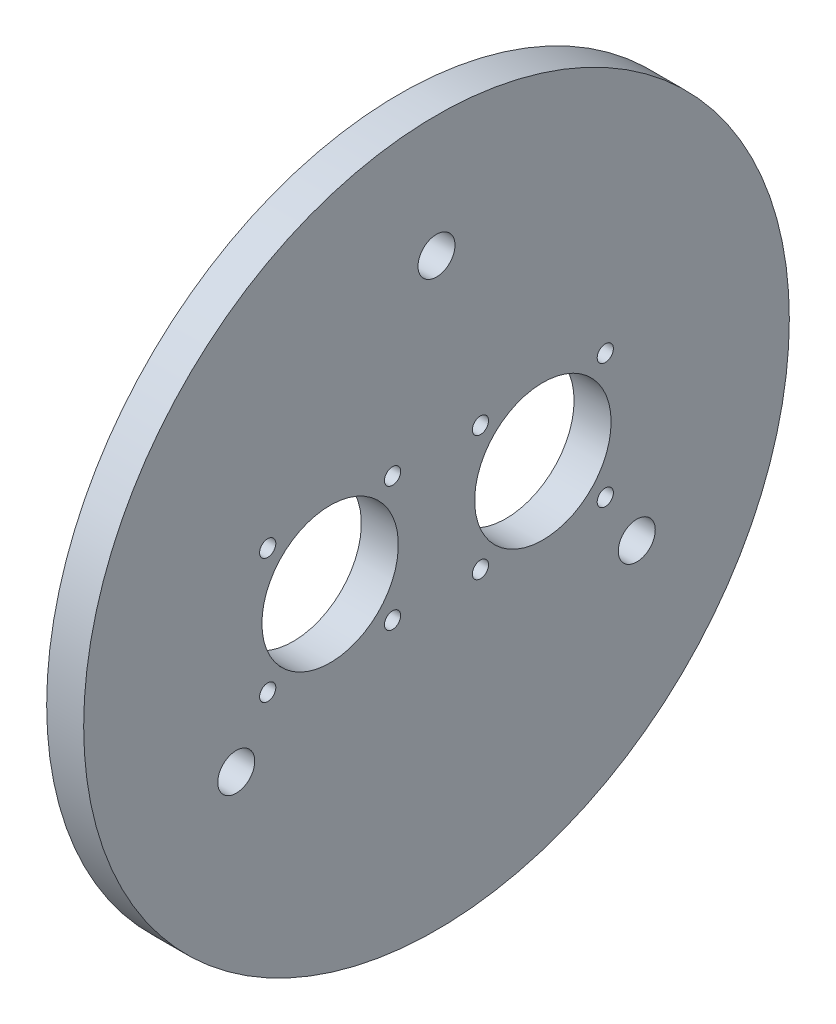
from build123d import *

# Parameters (mm, degrees)
SKETCH1_R           = 76.29
SKETCH1_R_2         = 4
SKETCH1_R_3         = 14.75
SKETCH1_R_4         = 1.75
BOSS_EXTRUDE1_DEPTH = 8


with BuildPart() as part:
    # Sketch1 → Boss-Extrude1 (new body)
    with BuildSketch(Plane(origin=(0, 0, 0), x_dir=(0, 0, -1), z_dir=(1, 0, 0))):
        Circle(SKETCH1_R)
        with Locations((0, 50)):
            Circle(SKETCH1_R_2, mode=Mode.SUBTRACT)
        with Locations((43.301270189, -25)):
            Circle(SKETCH1_R_2, mode=Mode.SUBTRACT)
        with Locations((-43.301270189, -25)):
            Circle(SKETCH1_R_2, mode=Mode.SUBTRACT)
        with Locations((23, 0)):
            Circle(SKETCH1_R_3, mode=Mode.SUBTRACT)
        with Locations((-23, 0)):
            Circle(SKETCH1_R_3, mode=Mode.SUBTRACT)
        with Locations((36.496900686, 13.496900686)):
            Circle(SKETCH1_R_4, mode=Mode.SUBTRACT)
        with Locations((36.496900686, -13.496900686)):
            Circle(SKETCH1_R_4, mode=Mode.SUBTRACT)
        with Locations((9.503099314, -13.496900686)):
            Circle(SKETCH1_R_4, mode=Mode.SUBTRACT)
        with Locations((9.503099314, 13.496900686)):
            Circle(SKETCH1_R_4, mode=Mode.SUBTRACT)
        with Locations((-36.496900686, -13.496900686)):
            Circle(SKETCH1_R_4, mode=Mode.SUBTRACT)
        with Locations((-9.503099314, -13.496900686)):
            Circle(SKETCH1_R_4, mode=Mode.SUBTRACT)
        with Locations((-9.503099314, 13.496900686)):
            Circle(SKETCH1_R_4, mode=Mode.SUBTRACT)
        with Locations((-36.496900686, 13.496900686)):
            Circle(SKETCH1_R_4, mode=Mode.SUBTRACT)
    extrude(amount=BOSS_EXTRUDE1_DEPTH)


solid = part.part
